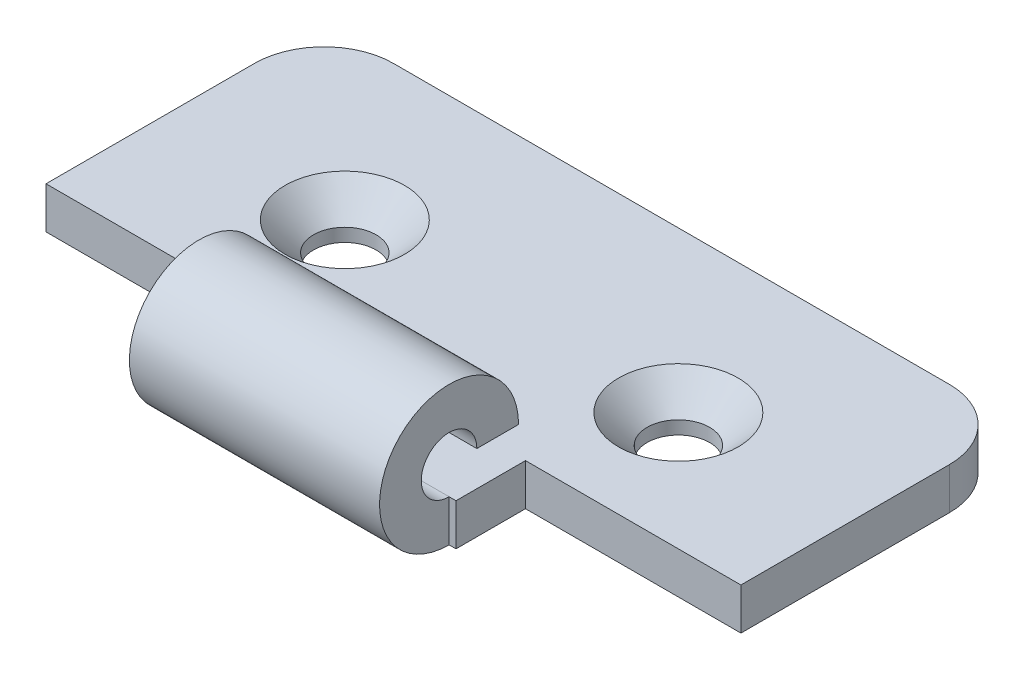
from build123d import *

# Parameters (mm, degrees)
SM_BASE_FLANGE_1_DEPTH   = 3
OTHER_START              = -9
OTHER_1_DEPTH            = 18
HOLE_WIZARD_2_AT_2_COUNT = 2
HOLE_WIZARD_2_AT_2_PITCH = 24


# Read off the part's stored shape, not the designer's step: 褶边1
# Sheet-metal steps are written as plain solids
with BuildPart() as part:
    # Sketch 1 → 基体-法兰1 (new body)
    with BuildSketch(Plane(origin=(0, 0, 0), x_dir=(1, 0, 0), z_dir=(0, 1, 0))):
        with BuildLine():
            Line((-9.5, -13.5), (9.5, -13.5))
            Line((9.5, -13.5), (9.5, -8.5))
            Line((9.5, -8.5), (25, -8.5))
            Line((25, -8.5), (25, 6.5))
            ThreePointArc((25, 6.5), (23.535533906, 10.035533906), (20, 11.5))
            Line((20, 11.5), (-20, 11.5))
            ThreePointArc((-20, 11.5), (-23.535533906, 10.035533906), (-25, 6.5))
            Line((-25, 6.5), (-25, -8.5))
            Line((-25, -8.5), (-9.5, -8.5))
            Line((-9.5, -8.5), (-9.5, -13.5))
        make_face()
    extrude(amount=-SM_BASE_FLANGE_1_DEPTH)

    # Other 1 outline → Other 1 (add)
    with BuildSketch(Plane.YZ.offset(OTHER_START)):
        with BuildLine():
            Line((2, 11.5), (2, 8.5))
            ThreePointArc((2, 8.5), (5.535533906, 17.035533906), (-3, 13.5))
            Line((-3, 13.5), (0, 13.5))
            ThreePointArc((0, 13.5), (3.414213562, 14.914213562), (2, 11.5))
        make_face()
    extrude(amount=OTHER_1_DEPTH)

    # 草图13 → 打孔尺寸(%根据十字)槽半沉头木螺钉的类型2 (revolve, cut)
    with BuildSketch(Plane(origin=(-12, 0, 0), x_dir=(0, 0, 1), z_dir=(1, 0, 0))):
        Polygon((0, 0), (0, 3), (2.25, 3), (2.25, 2.05), (4.3, 0), align=None)
    hole_wizard_2 = revolve(axis=Axis((-12, 6.35, 0), (0, -1, 0)), mode=Mode.SUBTRACT)

    # 打孔尺寸(%根据十字)槽半沉头木螺钉的类型2 at 2: 打孔尺寸(%根据十字)槽半沉头木螺钉的类型2 ×2
    with Locations(*[(i * HOLE_WIZARD_2_AT_2_PITCH, 0, 0) for i in range(1, HOLE_WIZARD_2_AT_2_COUNT)]):
        add(hole_wizard_2, mode=Mode.SUBTRACT)


solid = part.part
